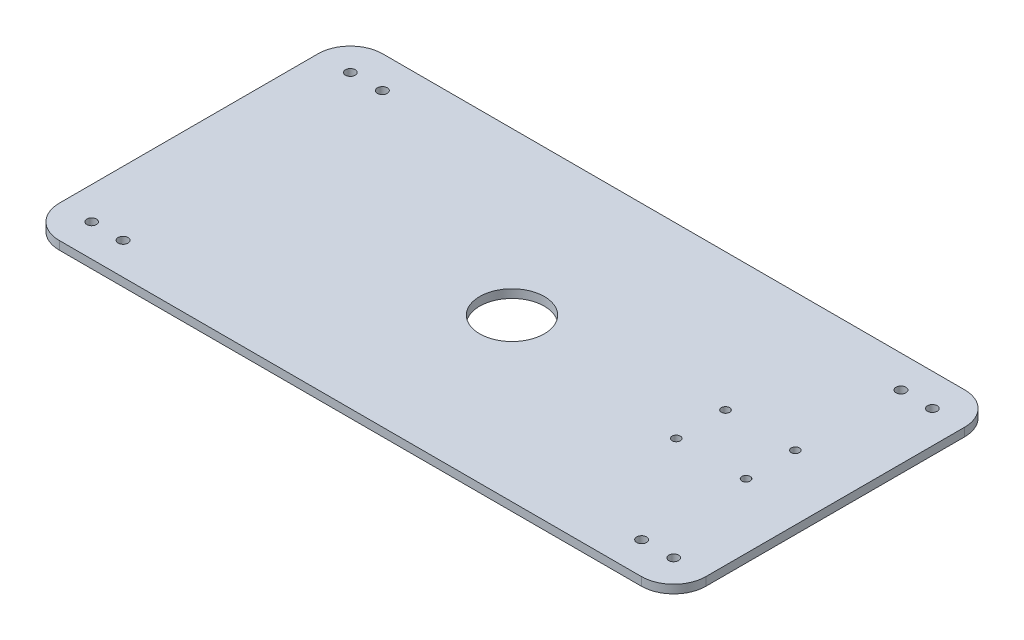
from build123d import *

# Parameters (mm, degrees)
SKETCH1_W               = 200
SKETCH1_H               = 100
BOSS_EXTRUDE1_DEPTH     = 2.6
FILLET1_R               = 10
SKETCH6_R               = 1.5
CUT_EXTRUDE6_DEPTH      = 2.6
MIRROR6_COPY_1_SKETCH_R = 1.5
MIRROR6_COPY_1_DEPTH    = 2.6
MIRROR6_COPY_2_SKETCH_R = 1.5
MIRROR6_COPY_2_DEPTH    = 2.6
SKETCH15_R              = 10
CUT_EXTRUDE14_DEPTH     = 224.621913059
SKETCH20_R              = 1.27
CUT_EXTRUDE15_DEPTH     = 224.621913059
SKETCH23_R              = 1.524
CUT_EXTRUDE16_DEPTH     = 2.59999988
MIRROR8_COPY_1_SKETCH_R = 1.524
MIRROR8_COPY_1_DEPTH    = 2.59999988
MIRROR8_COPY_2_SKETCH_R = 1.524
MIRROR8_COPY_2_DEPTH    = 2.59999988


with BuildPart() as part:
    # Sketch1 → Boss-Extrude1 (new body)
    with BuildSketch(Plane(origin=(0, 0, 0), x_dir=(1, 0, 0), z_dir=(0, 1, 0))):
        with Locations((100, -50)):
            Rectangle(SKETCH1_W, SKETCH1_H)
    extrude(amount=BOSS_EXTRUDE1_DEPTH)

    # Fillet1
    fillet1_edges = [part.edges().sort_by_distance(p)[0] for p in [
        (0, 1.3, 0),
        (0, 1.3, 100),
        (200, 1.3, 100),
        (200, 1.3, 0),
    ]]
    fillet(fillet1_edges, radius=FILLET1_R)

    # Sketch6 → Cut-Extrude6 (cut)
    with BuildSketch(Plane.XZ):
        with Locations((190, 10)):
            Circle(SKETCH6_R)
    cut_extrude6 = extrude(amount=-CUT_EXTRUDE6_DEPTH, mode=Mode.SUBTRACT)

    # Mirror5: Cut-Extrude6 across plane
    add(cut_extrude6.mirror(Plane(origin=(100, 0, 0), x_dir=(0, 0, 1), z_dir=(1, 0, 0))), mode=Mode.SUBTRACT)

    # Mirror6 copy 1 sketch → Mirror6 copy 1 (cut)
    with BuildSketch(Plane(origin=(200, 0, 100), x_dir=(-1, 0, 0), z_dir=(0, -1, 0))):
        with Locations((190, 10)):
            Circle(MIRROR6_COPY_1_SKETCH_R)
    extrude(amount=-MIRROR6_COPY_1_DEPTH, mode=Mode.SUBTRACT)

    # Mirror6 copy 2 sketch → Mirror6 copy 2 (cut)
    with BuildSketch(Plane(origin=(0, 0, 100), x_dir=(1, 0, 0), z_dir=(0, -1, 0))):
        with Locations((190, -10)):
            Circle(MIRROR6_COPY_2_SKETCH_R)
    extrude(amount=-MIRROR6_COPY_2_DEPTH, mode=Mode.SUBTRACT)

    # Sketch15 → Cut-Extrude14 (cut, through all)
    with BuildSketch(Plane.XZ):
        with Locations((100, 50)):
            Circle(SKETCH15_R)
    extrude(amount=-CUT_EXTRUDE14_DEPTH, mode=Mode.SUBTRACT)

    # Sketch20 → Cut-Extrude15 (cut, through all)
    with BuildSketch(Plane(origin=(0, 2.6, 0), x_dir=(1, 0, 0), z_dir=(0, 1, 0))):
        with Locations((158.41, -42.38)):
            Circle(SKETCH20_R)
        with Locations((180, -42.38)):
            Circle(SKETCH20_R)
        with Locations((158.41, -57.62)):
            Circle(SKETCH20_R)
        with Locations((180, -57.62)):
            Circle(SKETCH20_R)
    extrude(amount=-CUT_EXTRUDE15_DEPTH, mode=Mode.SUBTRACT)

    # Sketch23 → Cut-Extrude16 (cut)
    with BuildSketch(Plane(origin=(0, 2.6, 0), x_dir=(1, 0, 0), z_dir=(0, 1, 0))):
        with Locations((19.812, -9.906)):
            Circle(SKETCH23_R)
    cut_extrude16 = extrude(amount=-CUT_EXTRUDE16_DEPTH, mode=Mode.SUBTRACT)

    # Mirror7: Cut-Extrude16 across plane
    add(cut_extrude16.mirror(Plane(origin=(100, 0, 0), x_dir=(0, 0, 1), z_dir=(1, 0, 0))), mode=Mode.SUBTRACT)

    # Mirror8 copy 1 sketch → Mirror8 copy 1 (cut)
    with BuildSketch(Plane(origin=(200, 2.6, 100), x_dir=(-1, 0, 0), z_dir=(0, 1, 0))):
        with Locations((19.812, -9.906)):
            Circle(MIRROR8_COPY_1_SKETCH_R)
    extrude(amount=-MIRROR8_COPY_1_DEPTH, mode=Mode.SUBTRACT)

    # Mirror8 copy 2 sketch → Mirror8 copy 2 (cut)
    with BuildSketch(Plane(origin=(0, 2.6, 100), x_dir=(1, 0, 0), z_dir=(0, 1, 0))):
        with Locations((19.812, 9.906)):
            Circle(MIRROR8_COPY_2_SKETCH_R)
    extrude(amount=-MIRROR8_COPY_2_DEPTH, mode=Mode.SUBTRACT)


solid = part.part
